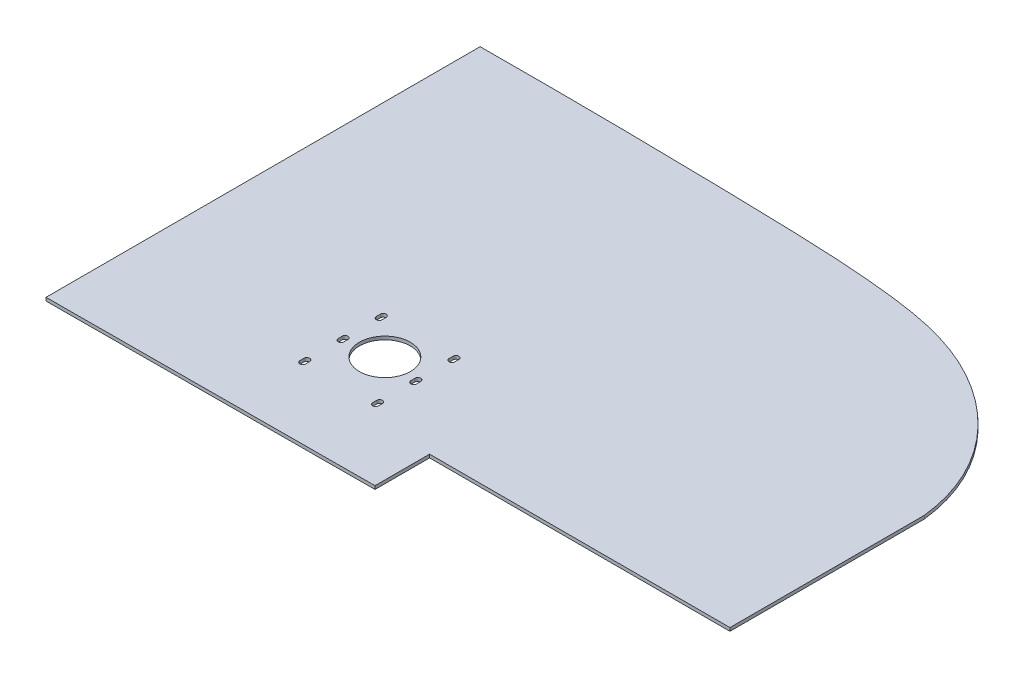
from build123d import *

# Parameters (mm, degrees)
CROQUIS3_R              = 18.65
SALIENTE_EXTRUIR1_DEPTH = 2.4


with BuildPart() as part:
    # Croquis3 → Saliente-Extruir1 (new body)
    with BuildSketch(Plane(origin=(0, 0, 0), x_dir=(1, 0, 0), z_dir=(0, 1, 0))):
        with BuildLine():
            Line((492.305943971, -125.244094236), (272.305943971, -125.244094236))
            Line((272.305943971, -125.244094236), (272.305943971, -165.244094236))
            Line((272.305943971, -165.244094236), (32.305943971, -166.244094236))
            Line((32.305943971, -166.244094236), (32.305943971, 151.755905764))
            add(Edge.make_bspline(
                [(32.305943971, 151.755905764), (102.587026573, 152.083038753), (202.508680675, 151.168168545), (322.867717166, 147.214046134), (426.028102706, 131.803827188), (486.021908836, 73.515372399), (492.305943971, 17.159454913)],
                knots=[0, 0, 0, 0, 0.403913238, 0.577103415, 0.694611051, 1, 1, 1, 1], degree=3))
            Line((492.305943971, 17.159454913), (492.305943971, -125.244094236))
        make_face()
        with Locations((194.205943971, -79.918767417)):
            Circle(CROQUIS3_R, mode=Mode.SUBTRACT)
        with BuildLine():
            Line((165.445943971, -57.418767417), (165.445943971, -54.418767417))
            ThreePointArc((165.445943971, -54.418767417), (167.545943971, -52.318767417), (169.645943971, -54.418767417))
            Line((169.645943971, -54.418767417), (169.645943971, -57.418767417))
            ThreePointArc((169.645943971, -57.418767417), (167.545943971, -59.518767417), (165.445943971, -57.418767417))
        make_face(mode=Mode.SUBTRACT)
        with BuildLine():
            Line((222.965943971, -57.418767417), (222.965943971, -54.418767417))
            ThreePointArc((222.965943971, -54.418767417), (220.865943971, -52.318767417), (218.765943971, -54.418767417))
            Line((218.765943971, -54.418767417), (218.765943971, -57.418767417))
            ThreePointArc((218.765943971, -57.418767417), (220.865943971, -59.518767417), (222.965943971, -57.418767417))
        make_face(mode=Mode.SUBTRACT)
        with BuildLine():
            Line((222.965943971, -85.418767417), (222.965943971, -82.418767417))
            ThreePointArc((222.965943971, -82.418767417), (220.865943971, -80.318767417), (218.765943971, -82.418767417))
            Line((218.765943971, -82.418767417), (218.765943971, -85.418767417))
            ThreePointArc((218.765943971, -85.418767417), (220.865943971, -87.518767417), (222.965943971, -85.418767417))
        make_face(mode=Mode.SUBTRACT)
        with BuildLine():
            Line((222.965943971, -113.418767417), (222.965943971, -110.418767417))
            ThreePointArc((222.965943971, -110.418767417), (220.865943971, -108.318767417), (218.765943971, -110.418767417))
            Line((218.765943971, -110.418767417), (218.765943971, -113.418767417))
            ThreePointArc((218.765943971, -113.418767417), (220.865943971, -115.518767417), (222.965943971, -113.418767417))
        make_face(mode=Mode.SUBTRACT)
        with BuildLine():
            Line((169.645943971, -85.418767417), (169.645943971, -82.418767417))
            ThreePointArc((169.645943971, -82.418767417), (167.545943971, -80.318767417), (165.445943971, -82.418767417))
            Line((165.445943971, -82.418767417), (165.445943971, -85.418767417))
            ThreePointArc((165.445943971, -85.418767417), (167.545943971, -87.518767417), (169.645943971, -85.418767417))
        make_face(mode=Mode.SUBTRACT)
        with BuildLine():
            Line((169.645943971, -113.418767417), (169.645943971, -110.418767417))
            ThreePointArc((169.645943971, -110.418767417), (167.545943971, -108.318767417), (165.445943971, -110.418767417))
            Line((165.445943971, -110.418767417), (165.445943971, -113.418767417))
            ThreePointArc((165.445943971, -113.418767417), (167.545943971, -115.518767417), (169.645943971, -113.418767417))
        make_face(mode=Mode.SUBTRACT)
    extrude(amount=SALIENTE_EXTRUIR1_DEPTH)


solid = part.part
